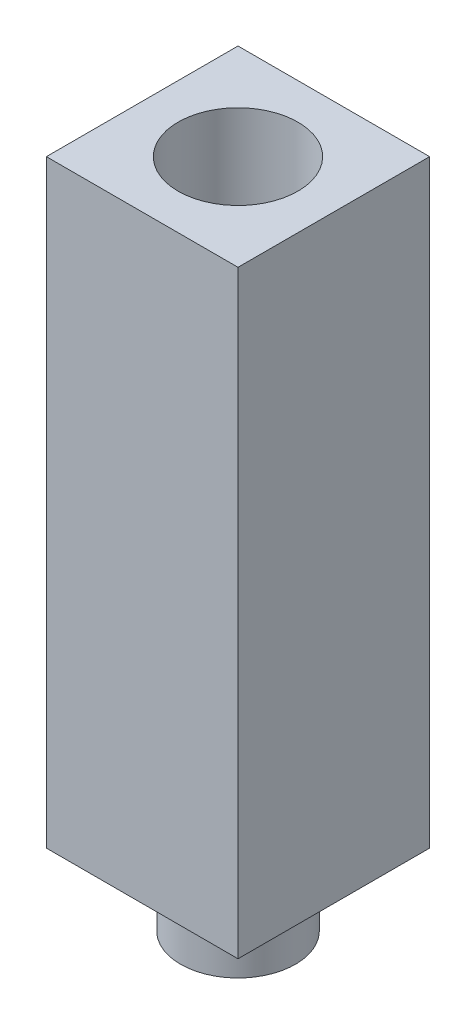
from build123d import *

# Parameters (mm, degrees)
SKETCH1_R           = 2.4
BOSS_EXTRUDE1_DEPTH = 3
SKETCH2_W           = 8
SKETCH2_H           = 8
BOSS_EXTRUDE2_DEPTH = 25
SKETCH3_R           = 2.5
CUT_EXTRUDE1_DEPTH  = 4


with BuildPart() as part:
    # Sketch1 → Boss-Extrude1 (new body)
    with BuildSketch(Plane(origin=(0, 0, 0), x_dir=(1, 0, 0), z_dir=(0, 1, 0))):
        Circle(SKETCH1_R)
    extrude(amount=BOSS_EXTRUDE1_DEPTH)

    # Sketch2 → Boss-Extrude2 (add)
    with BuildSketch(Plane(origin=(0, 3, 0), x_dir=(1, 0, 0), z_dir=(0, 1, 0))):
        Rectangle(SKETCH2_W, SKETCH2_H)
    extrude(amount=BOSS_EXTRUDE2_DEPTH)

    # Sketch3 → Cut-Extrude1 (cut)
    with BuildSketch(Plane(origin=(0, 28, 0), x_dir=(1, 0, 0), z_dir=(0, 1, 0))):
        Circle(SKETCH3_R)
    extrude(amount=-CUT_EXTRUDE1_DEPTH, mode=Mode.SUBTRACT)


solid = part.part
